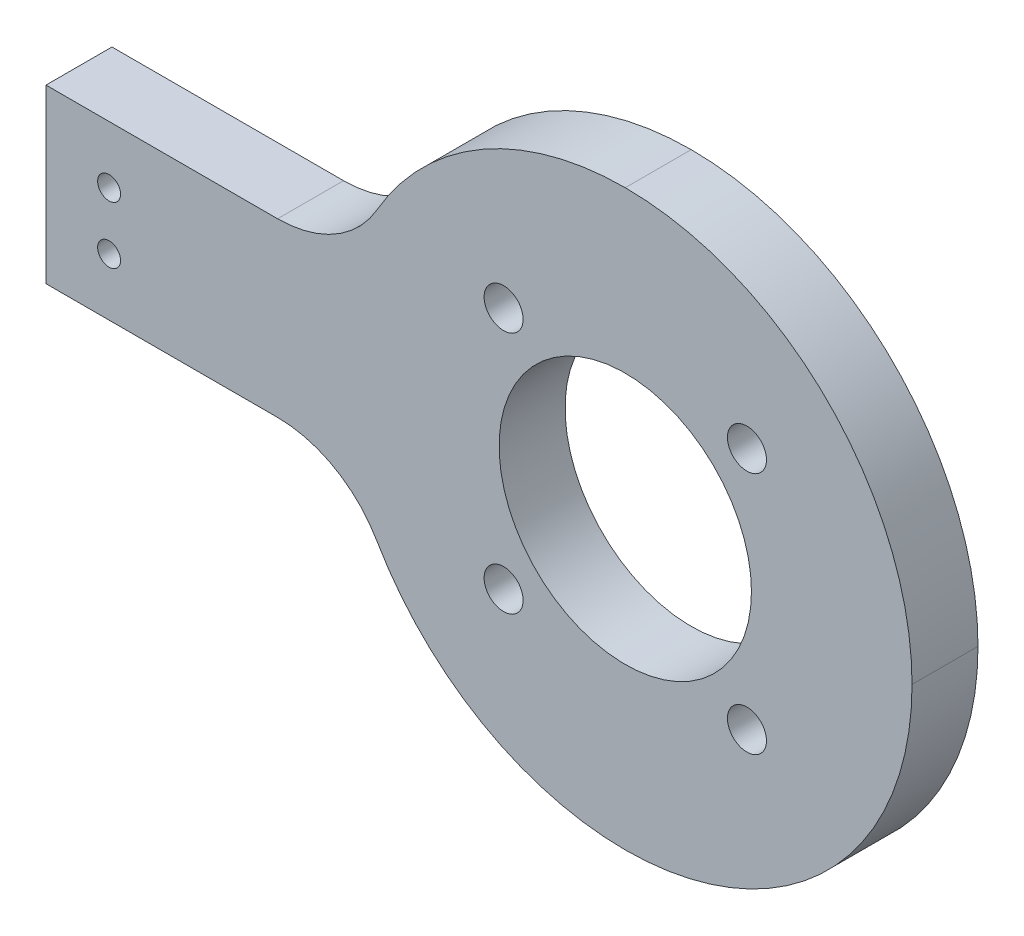
from build123d import *

# Parameters (mm, degrees)
SKETCH2_W            = 100
SKETCH2_H            = 5.75
BOSS_EXTRUDE1_DEPTH  = 50
SKETCH4_R            = 11
CUT_EXTRUDE1_DEPTH   = 112.951161227
M3_CLEARANCE_HOLE2_D = 3.4
CUT_EXTRUDE3_DEPTH   = 5.75
FILLET1_R            = 25
FILLET2_R            = 10
M3_CLEARANCE_HOLE3_D = 3.4
SKETCH12_R           = 1
SKETCH12_W           = 24.5
SKETCH12_H           = 15
CUT_EXTRUDE4_DEPTH   = 5.75


with BuildPart() as part:
    # Sketch2 → Boss-Extrude1 (new body)
    with BuildSketch(Plane(origin=(0, 0, 0), x_dir=(1, 0, 0), z_dir=(0, 1, 0))):
        with Locations((-50, 2.875)):
            Rectangle(SKETCH2_W, SKETCH2_H)
    extrude(amount=BOSS_EXTRUDE1_DEPTH)

    # Sketch4 → Cut-Extrude1 (cut, through all)
    with BuildSketch(Plane.XY):
        with Locations((-25, 25)):
            Circle(SKETCH4_R)
    extrude(amount=-CUT_EXTRUDE1_DEPTH, mode=Mode.SUBTRACT)

    # M3 Clearance Hole2 (through all)
    with Locations(Plane.XY):
        with Locations((-35.606601718, 14.393398282), (-35.606601718, 35.606601718), (-14.393398282, 35.606601718), (-14.393398282, 14.393398282)):
            Hole(M3_CLEARANCE_HOLE2_D / 2)

    # Sketch9 → Cut-Extrude3 (cut)
    with BuildSketch(Plane.XY):
        with BuildLine():
            Line((-25, 50), (-100, 50))
            Line((-100, 50), (-100, 32.5))
            Line((-100, 32.5), (-48.848480035, 32.5))
            ThreePointArc((-48.848480035, 32.5), (-39.790199458, 45.155644371), (-25, 50))
        make_face()
        with BuildLine():
            Line((-25, 0), (-100, 0))
            Line((-100, 0), (-100, 17.5))
            Line((-100, 17.5), (-48.848480035, 17.5))
            ThreePointArc((-48.848480035, 17.5), (-39.790199458, 4.844355629), (-25, 0))
        make_face()
    extrude(amount=-CUT_EXTRUDE3_DEPTH, mode=Mode.SUBTRACT)

    # Fillet1
    fillet1_edges = [part.edges().sort_by_distance(p)[0] for p in [
        (0, 0, -2.875),
        (0, 50, -2.875),
    ]]
    fillet(fillet1_edges, radius=FILLET1_R - 0.0001)  # a hair under: the kernel refuses the full size

    # Fillet2
    fillet2_edges = [part.edges().sort_by_distance(p)[0] for p in [
        (-48.848480035, 32.5, -2.875),
        (-48.848480035, 17.5, -2.875),
    ]]
    fillet(fillet2_edges, radius=FILLET2_R)

    # M3 Clearance Hole3 (through all)
    with Locations(Plane.XY):
        with Locations((-94, 28.5), (-94, 21.5)):
            Hole(M3_CLEARANCE_HOLE3_D / 2)

    # Sketch12 → Cut-Extrude4 (cut)
    with BuildSketch(Plane.XY):
        with Locations((-70, 27.5)):
            Circle(SKETCH12_R)
        with Locations((-70, 22.5)):
            Circle(SKETCH12_R)
        with Locations((-87.75, 25)):
            Rectangle(SKETCH12_W, SKETCH12_H)
    extrude(amount=-CUT_EXTRUDE4_DEPTH, mode=Mode.SUBTRACT)


solid = part.part
